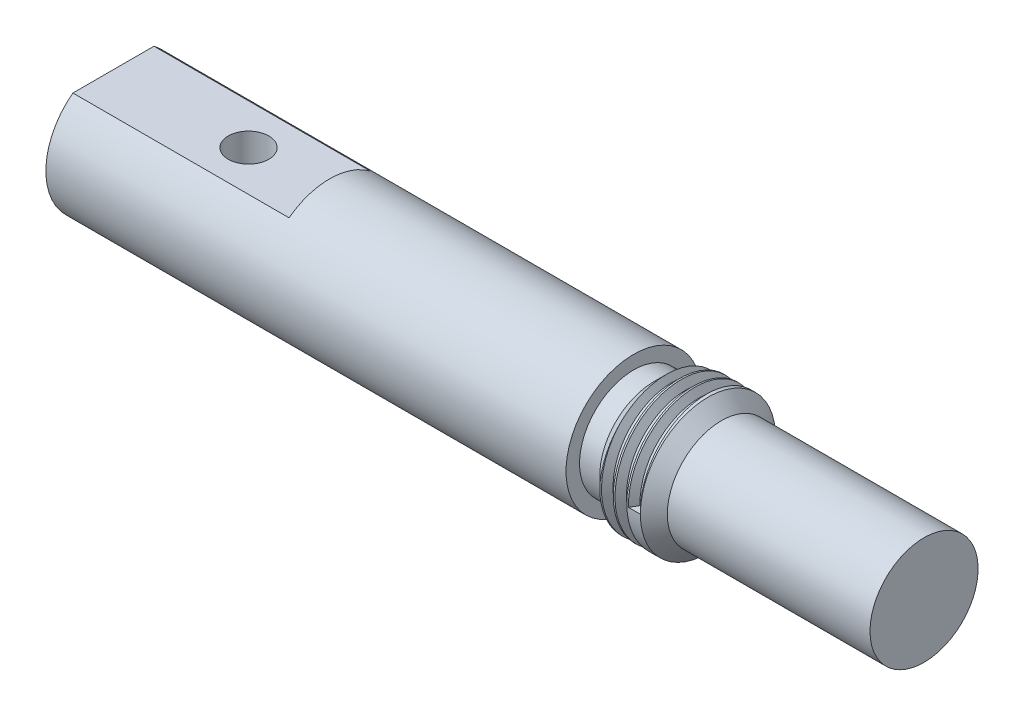
from build123d import *

# Parameters (mm, degrees)
CUT_EXTRUDE1_START    = -16
CUT_EXTRUDE1_DEPTH    = 16
F_3_0MM_DOWEL_HOLE1_D = 3
CUT_EXTRUDE3_START    = -20
SKETCH17_R            = 5
SKETCH17_R_2          = 4
CUT_EXTRUDE3_DEPTH    = 1.5
CHAMFER2_SIZE         = 1
THREAD2_PITCH         = 1


with BuildPart() as part:
    # Sketch1 → Revolve1 (revolve)
    with BuildSketch(Plane.XY, mode=Mode.PRIVATE) as revolve1_sk:
        Polygon((0, 0), (0, 5), (45, 5), (45, 4), (60, 4), (60, 0), align=None)
    revolve(revolve1_sk.sketch.rotate(Axis((0, 0, 0), (1, 0, 0)), 90), axis=Axis((0, 0, 0), (1, 0, 0)))

    # Sketch2 → Cut-Extrude1 (cut)
    with BuildSketch(Plane.ZY.offset(CUT_EXTRUDE1_START)):
        with BuildLine():
            Line((-3, 4), (3, 4))
            ThreePointArc((3, 4), (0, 5), (-3, 4))
        make_face()
        with BuildLine():
            Line((3, -4), (-3, -4))
            ThreePointArc((-3, -4), (0, -5), (3, -4))
        make_face()
    extrude(amount=CUT_EXTRUDE1_DEPTH, mode=Mode.SUBTRACT)

    # Ø3.0mm Dowel Hole1 (through all)
    with Locations(Plane(origin=(0, 4, 0), x_dir=(1, 0, 0), z_dir=(0, 1, 0))):
        with Locations((10, 0)):
            Hole(F_3_0MM_DOWEL_HOLE1_D / 2)

    # Sketch17 → Cut-Extrude3 (cut)
    with BuildSketch(Plane(origin=(60, 0, 0), x_dir=(0, 0, -1), z_dir=(1, 0, 0)).offset(CUT_EXTRUDE3_START)):
        with Locations(Location((0, 0, 0), (0, 0, 180))):
            Circle(SKETCH17_R)
        with Locations(Location((0, 0, 0), (0, 0, 180))):
            Circle(SKETCH17_R_2, mode=Mode.SUBTRACT)
    extrude(amount=-CUT_EXTRUDE3_DEPTH, mode=Mode.SUBTRACT)

    # Chamfer2
    chamfer2_edges = [part.edges().sort_by_distance(p)[0] for p in [
        (40, 0, -5),
        (45, 0, -5),
    ]]
    chamfer(chamfer2_edges, length=CHAMFER2_SIZE - 0.0001)  # a hair under: the kernel refuses the full size

    # Thread2: the profile of Thread Profile2 profile screwed along a right-hand helix of 3 turns, 8 arcs to a turn; built about Z, then put on its axis
    thread2_z = Axis((0, 0, 0), (0, 0, 1))
    thread2_corners = [(5.0003, 0, -0.000173205), (5.0003, 0, 0.875173202), (4.458734125, 0, 0.562499999), (4.458734125, 0, 0.312499999)]
    with BuildLine(mode=Mode.PRIVATE) as thread2_profile:
        Line(thread2_corners[0], thread2_corners[1])
        Line(thread2_corners[1], thread2_corners[2])
        Line(thread2_corners[2], thread2_corners[3])
        Line(thread2_corners[3], thread2_corners[0])
    thread2_cap = Face(thread2_profile.wire())
    thread2_turn_angles = [0, 22.5, 45, 67.5, 90, 112.5, 135, 157.5, 180, 202.5, 225, 247.5, 270, 292.5, 315, 337.5, 360]
    thread2_turn_weights = [1, 0.9238795325112867, 1, 0.9238795325112867, 1, 0.9238795325112867, 1, 0.9238795325112867, 1, 0.9238795325112867, 1, 0.9238795325112867, 1, 0.9238795325112867, 1, 0.9238795325112867, 1]
    thread2_turn_rails = [Edge.make_bspline([Vector(p[0], p[1], 0).rotate(thread2_z, thread2_turn_angles[k]) / thread2_turn_weights[k] + Vector(0, 0, p[2] + THREAD2_PITCH * thread2_turn_angles[k] / 360) for k in range(17)], [0, 0, 0, 1, 1, 2, 2, 3, 3, 4, 4, 5, 5, 6, 6, 7, 7, 8, 8, 8], 2, thread2_turn_weights) for p in thread2_corners]
    thread2_turn_sides = [Face.make_surface_from_curves(thread2_turn_rails[p[0]], thread2_turn_rails[p[1]]) for p in [(0, 1), (1, 2), (2, 3), (3, 0)]]
    thread2 = Plane(origin=(44, 0, 0), x_dir=(0, 0, 1), z_dir=(-1, 0, 0)) * Solid(Shell([*[p.moved(Location((0, 0, THREAD2_PITCH * i))) for i in range(3) for p in thread2_turn_sides], thread2_cap, thread2_cap.rotate(thread2_z, 1080).moved(Location((0, 0, THREAD2_PITCH * 1080 / 360)))]))
    add(thread2, mode=Mode.SUBTRACT)


solid = part.part
